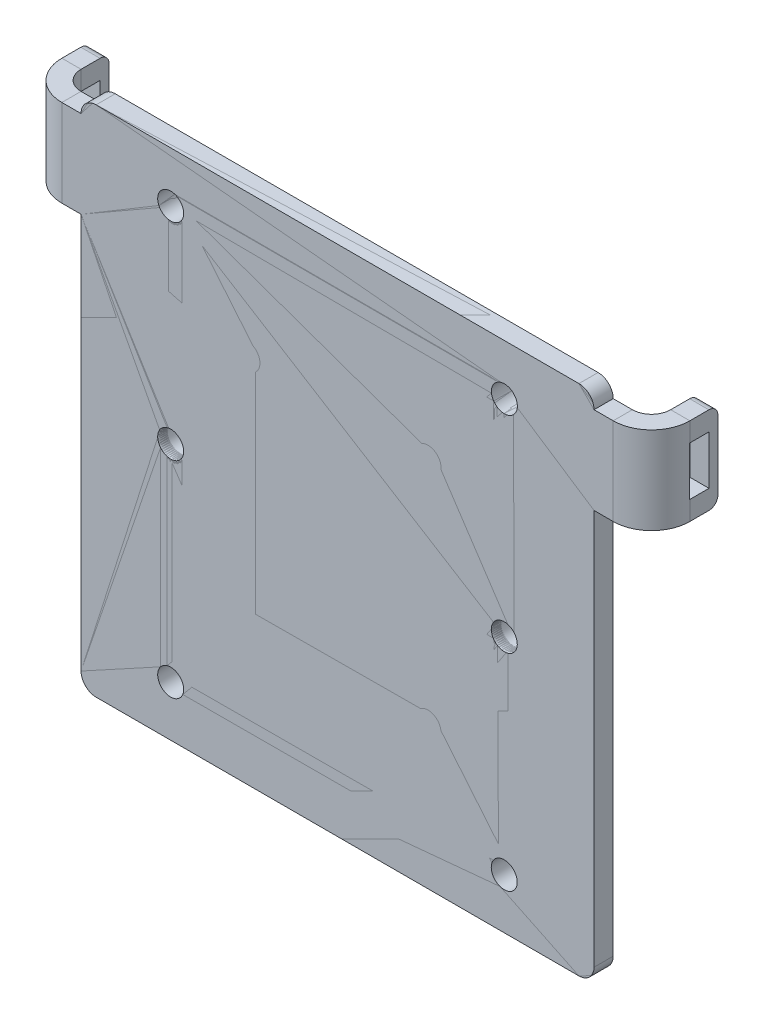
from build123d import *

# Parameters (mm, degrees)
BOSS_EXTRUDE1_DEPTH = 3.175
SKETCH3_W           = 3.175
SKETCH3_H           = 14.45471055
BOSS_EXTRUDE2_DEPTH = 3.175
BASE_FLANGE1_DEPTH  = 3.175
EDGE_FLANGE2_DEPTH  = 14.454709976
SKETCH16_W          = 3.175
SKETCH16_H          = 14.454709976
TAB1_DEPTH          = 3.175
EDGE_FLANGE3_DEPTH  = 14.454709976
SKETCH22_W          = 3.3
SKETCH22_H          = 8.104709976
CUT_EXTRUDE1_DEPTH  = 416.916669348
SKETCH23_W          = 3.175
SKETCH23_H          = 14.45471055
BASE_FLANGE2_DEPTH  = 3.175
EDGE_FLANGE4_DEPTH  = 14.45471055
TAB2_START          = -3.175
TAB2_DEPTH          = 3.175
EDGE_FLANGE5_DEPTH  = 14.45471055
SKETCH35_W          = 3.206881028
SKETCH35_H          = 8.10471055
CUT_EXTRUDE2_DEPTH  = 416.916669349
SKETCH37_R          = 2.15
CUT_EXTRUDE3_DEPTH  = 10
FILLET1_R           = 1.5
FILLET3_R           = 1.5
SKETCH83_R          = 5.65
CUT_EXTRUDE6_DEPTH  = 1.5875
SKETCH84_R          = 2.15
CUT_EXTRUDE7_DEPTH  = 3.175


# Sheet-metal steps are written as plain solids
with BuildPart() as part:
    # Sketch2 → Boss-Extrude1 (new body)
    with BuildSketch(Plane.XY):
        with BuildLine():
            Line((40, 42.5), (-40, 42.5))
            ThreePointArc((-40, 42.5), (-41.767766953, 41.767766953), (-42.5, 40))
            Line((-42.5, 40), (-42.5, -40))
            ThreePointArc((-42.5, -40), (-41.767766953, -41.767766953), (-40, -42.5))
            Line((-40, -42.5), (40, -42.5))
            ThreePointArc((40, -42.5), (41.767766953, -41.767766953), (42.5, -40))
            Line((42.5, -40), (42.5, 40))
            ThreePointArc((42.5, 40), (41.767766953, 41.767766953), (40, 42.5))
        make_face()
    extrude(amount=BOSS_EXTRUDE1_DEPTH)

    # Sketch3 → Boss-Extrude2 (add)
    with BuildSketch(Plane.ZY.offset(42.5)):
        with Locations((1.5875, 32.772644725)):
            Rectangle(SKETCH3_W, SKETCH3_H)
    extrude(amount=BOSS_EXTRUDE2_DEPTH)


with BuildPart() as body_2:
    # Sketch5 → Base-Flange1 (new body)
    with BuildSketch(Plane(origin=(0, 0, 0), x_dir=(-1, 0, 0), z_dir=(0, 0, -1))):
        with BuildLine():
            Line((-40, 317.487012749), (40, 317.487012749))
            ThreePointArc((40, 317.487012749), (41.767766883, 318.219245767), (42.5, 319.98701265))
            Line((42.5, 319.98701265), (45.675, 319.98701265))
            Line((45.675, 319.98701265), (45.675, 334.441722626))
            Line((45.675, 334.441722626), (42.5, 334.441722626))
            Line((42.5, 334.441722626), (42.5, 399.987009476))
            ThreePointArc((42.5, 399.987009476), (41.767766953, 401.754776429), (40, 402.487009377))
            Line((40, 402.487009377), (-40, 402.487009376))
            ThreePointArc((-40, 402.487009376), (-41.767766883, 401.754776358), (-42.5, 399.987009476))
            Line((-42.5, 399.987009476), (-42.5, 319.98701265))
            ThreePointArc((-42.5, 319.98701265), (-41.767766953, 318.219245697), (-40, 317.487012749))
        make_face()
    extrude(amount=-BASE_FLANGE1_DEPTH)

    # Edge-Flange2 section (across the edge) → Edge-Flange2 (add)
    with BuildSketch(Plane(origin=(-48.85, 319.98701265, 0), x_dir=(1.0, -2.5355913511954643e-12, -3.3713179097539844e-15), z_dir=(2.5355913511954643e-12, 1.0, 0))):
        with BuildLine():
            Line((-3.175, 3.175), (-3.175, 12.825))
            Line((-3.175, 12.825), (0, 12.825))
            Line((0, 12.825), (0, 3.175))
            ThreePointArc((0, 3.175), (0.92993597, 0.92993597), (3.175, 0))
            Line((3.175, 0), (3.175, -3.175))
            ThreePointArc((3.175, -3.175), (-1.315128061, -1.315128061), (-3.175, 3.175))
        make_face()
    extrude(amount=EDGE_FLANGE2_DEPTH)

    # Sketch16 → Tab1 (add)
    with BuildSketch(Plane.XY.offset(3.175)):
        with Locations((44.0875, 327.214367638)):
            Rectangle(SKETCH16_W, SKETCH16_H)
    extrude(amount=-TAB1_DEPTH)

    # Edge-Flange3 section (across the edge) → Edge-Flange3 (add)
    with BuildSketch(Plane(origin=(48.85, 334.441722626, 0), x_dir=(-1, 0, 0), z_dir=(0, -1, 0))):
        with BuildLine():
            Line((-3.175, 3.175), (-3.175, 12.825))
            Line((-3.175, 12.825), (0, 12.825))
            Line((0, 12.825), (0, 3.175))
            ThreePointArc((0, 3.175), (0.92993597, 0.92993597), (3.175, 0))
            Line((3.175, 0), (3.175, -3.175))
            ThreePointArc((3.175, -3.175), (-1.315128061, -1.315128061), (-3.175, 3.175))
        make_face()
    extrude(amount=EDGE_FLANGE3_DEPTH)

    # Sketch22 → Cut-Extrude1 (cut, through all)
    with BuildSketch(Plane(origin=(52.025, 0, 0), x_dir=(0, 0, -1), z_dir=(1, 0, 0))):
        with Locations((8, 327.214367638)):
            Rectangle(SKETCH22_W, SKETCH22_H)
    extrude(amount=-CUT_EXTRUDE1_DEPTH, mode=Mode.SUBTRACT)


with BuildPart() as body_3:
    # Sketch23 → Base-Flange2 (new body)
    with BuildSketch(Plane.XY.offset(3.175)):
        with Locations((44.0875, 32.772644725)):
            Rectangle(SKETCH23_W, SKETCH23_H)
    extrude(amount=-BASE_FLANGE2_DEPTH)

    # Edge-Flange4 section (across the edge) → Edge-Flange4 (add)
    with BuildSketch(Plane(origin=(48.85, 40, 0), x_dir=(-1, 0, 0), z_dir=(0, -1, 0))):
        with BuildLine():
            Line((-3.175, 3.175), (-3.175, 7.825))
            Line((-3.175, 7.825), (0, 7.825))
            Line((0, 7.825), (0, 3.175))
            ThreePointArc((0, 3.175), (0.92993597, 0.92993597), (3.175, 0))
            Line((3.175, 0), (3.175, -3.175))
            ThreePointArc((3.175, -3.175), (-1.315128061, -1.315128061), (-3.175, 3.175))
        make_face()
    extrude(amount=EDGE_FLANGE4_DEPTH)

    # Sketch29 → Tab2 (add)
    with BuildSketch(Plane.XY.offset(3.175).offset(TAB2_START)):
        with BuildLine():
            Line((40, 42.5), (-40, 42.5))
            ThreePointArc((-40, 42.5), (-41.767766953, 41.767766953), (-42.5, 40))
            Line((-42.5, 40), (-45.675, 40))
            Line((-45.675, 40), (-45.675, 25.54528945))
            Line((-45.675, 25.54528945), (-42.5, 25.54528945))
            Line((-42.5, 25.54528945), (-42.5, -40))
            ThreePointArc((-42.5, -40), (-41.767766953, -41.767766953), (-40, -42.5))
            Line((-40, -42.5), (40, -42.5))
            ThreePointArc((40, -42.5), (41.767766953, -41.767766953), (42.5, -40))
            Line((42.5, -40), (42.5, 40))
            ThreePointArc((42.5, 40), (41.767766953, 41.767766953), (40, 42.5))
        make_face()
    extrude(amount=TAB2_DEPTH)

    # Edge-Flange5 section (across the edge) → Edge-Flange5 (add)
    with BuildSketch(Plane(origin=(-48.85, 25.54528945, 0), x_dir=(1.0, 2.5355912505953007e-12, -3.491481338843134e-15), z_dir=(-2.5355912505953007e-12, 1.0, 0))):
        with BuildLine():
            Line((-3.175, 3.175), (-3.175, 7.825))
            Line((-3.175, 7.825), (0, 7.825))
            Line((0, 7.825), (0, 3.175))
            ThreePointArc((0, 3.175), (0.92993597, 0.92993597), (3.175, 0))
            Line((3.175, 0), (3.175, -3.175))
            ThreePointArc((3.175, -3.175), (-1.315128061, -1.315128061), (-3.175, 3.175))
        make_face()
    extrude(amount=EDGE_FLANGE5_DEPTH)

    # Sketch35 → Cut-Extrude2 (cut, through all)
    with BuildSketch(Plane(origin=(52.025, 0, 0), x_dir=(0, 0, -1), z_dir=(1, 0, 0))):
        with Locations((4.746559486, 32.772644725)):
            Rectangle(SKETCH35_W, SKETCH35_H)
    extrude(amount=-CUT_EXTRUDE2_DEPTH, mode=Mode.SUBTRACT)

    # Sketch37 → Cut-Extrude3 (cut)
    with BuildSketch(Plane(origin=(0, 0, 0), x_dir=(-1, 0, 0), z_dir=(0, 0, -1))):
        with Locations(Location((15, -19, 0), (0, 0, 90))):
            Circle(SKETCH37_R)
        with Locations(Location((-15, -19, 0), (0, 0, 90))):
            Circle(SKETCH37_R)
        with Locations(Location((-15, 19, 0), (0, 0, 90))):
            Circle(SKETCH37_R)
        with Locations(Location((15, 19, 0), (0, 0, 90))):
            Circle(SKETCH37_R)
    extrude(amount=-CUT_EXTRUDE3_DEPTH, mode=Mode.SUBTRACT)

    # Fillet1
    fillet1_edges = [body_3.edges().sort_by_distance(p)[0] for p in [
        (-50.4375, 25.54528945, -7.825),
        (-50.4375, 40, -7.825),
    ]]
    fillet(fillet1_edges, radius=FILLET1_R)

    # Fillet3
    fillet3_edges = [body_3.edges().sort_by_distance(p)[0] for p in [
        (50.4375, 40, -7.825),
        (50.4375, 25.54528945, -7.825),
    ]]
    fillet(fillet3_edges, radius=FILLET3_R)

    # Sketch83 → Cut-Extrude6 (cut)
    with BuildSketch(Plane(origin=(0, 0, 0), x_dir=(-1, 0, 0), z_dir=(0, 0, -1))):
        with Locations((-27.631664561, -0.011364409)):
            Circle(SKETCH83_R)
        with Locations((27.648134603, 0)):
            Circle(SKETCH83_R)
    extrude(amount=-CUT_EXTRUDE6_DEPTH, mode=Mode.SUBTRACT)


with BuildPart() as cut_extrude7_tool:
    # Sketch84 → Cut-Extrude7 (new body)
    with BuildSketch(Plane(origin=(-1566.834955088, -600.382325289, 3.175), x_dir=(0.0002055797814798681, 0.9999999788684766, 0), z_dir=(0, 0, 1))):
        with Locations(Location((566.544006473, -1539.070383016, 0), (0, 0, 270.011778854))):
            Circle(SKETCH84_R)
        with Locations(Location((600.698738292, -1539.063361493, 0), (0, 0, 270.011778854))):
            Circle(SKETCH84_R)
        with Locations(Location((634.853470111, -1539.056339971, 0), (0, 0, 270.011778854))):
            Circle(SKETCH84_R)
        with BuildLine():
            add(Edge.make_bspline(
                [(634.853912108, -1592.200183392), (630.553912199, -1592.199299399), (630.553028206, -1596.499299308), (634.853028115, -1596.500183301), (639.153028024, -1596.501067294), (639.153912017, -1592.201067385), (634.853912108, -1592.200183392)],
                knots=[0, 0, 0, 0, 0.5, 0.5, 0.5, 1, 1, 1, 1], degree=3, weights=[1, 0.333333333, 0.333333333, 1, 0.333333333, 0.333333333, 1]))
        make_face()
        with BuildLine():
            add(Edge.make_bspline(
                [(600.698296296, -1596.493161779), (604.998296205, -1596.494045772), (604.999180198, -1592.194045863), (600.699180289, -1592.19316187), (596.39918038, -1592.192277877), (596.398296386, -1596.492277786), (600.698296296, -1596.493161779)],
                knots=[0, 0, 0, 0, 0.5, 0.5, 0.5, 1, 1, 1, 1], degree=3, weights=[1, 0.333333333, 0.333333333, 1, 0.333333333, 0.333333333, 1]))
        make_face()
        with BuildLine():
            add(Edge.make_bspline(
                [(566.543564476, -1596.486140257), (570.843564385, -1596.48702425), (570.844448378, -1592.187024341), (566.544448469, -1592.186140348), (562.24444856, -1592.185256355), (562.243564567, -1596.485256264), (566.543564476, -1596.486140257)],
                knots=[0, 0, 0, 0, 0.5, 0.5, 0.5, 1, 1, 1, 1], degree=3, weights=[1, 0.333333333, 0.333333333, 1, 0.333333333, 0.333333333, 1]))
        make_face()
    extrude(amount=-CUT_EXTRUDE7_DEPTH)


with BuildPart() as part_1:
    add(part.part)

    # Cut-Extrude7: cut by cut_extrude7_tool
    add(cut_extrude7_tool.part, mode=Mode.SUBTRACT)


with BuildPart() as body_3_1:
    add(body_3.part)

    # Cut-Extrude7: cut by cut_extrude7_tool
    add(cut_extrude7_tool.part, mode=Mode.SUBTRACT)


solid = Compound([part_1.part, body_3_1.part])
